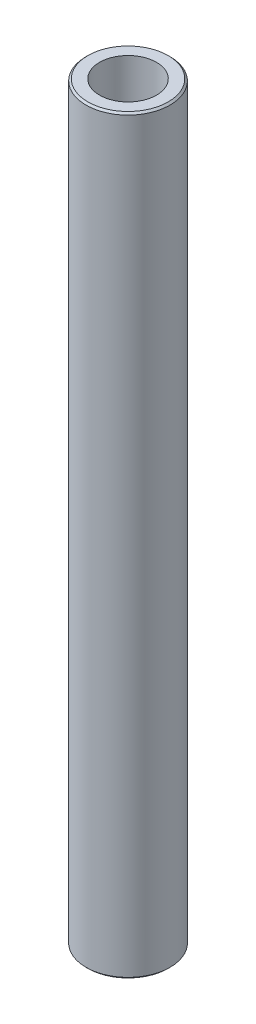
from build123d import *

# Parameters (mm, degrees)
SKETCH1_R           = 12.5
BOSS_EXTRUDE1_DEPTH = 223.375860077
SKETCH2_R           = 8.478781611
CUT_EXTRUDE1_DEPTH  = 225.074261943
CHAMFER1_SIZE       = 0.546231855


with BuildPart() as part:
    # Sketch1 → Boss-Extrude1 (new body)
    with BuildSketch(Plane(origin=(0, 0, 0), x_dir=(1, 0, 0), z_dir=(0, 1, 0))):
        Circle(SKETCH1_R)
    extrude(amount=BOSS_EXTRUDE1_DEPTH)

    # Sketch2 → Cut-Extrude1 (cut, through all)
    with BuildSketch(Plane(origin=(0, 0, 0), x_dir=(1, 0, 0), z_dir=(0, 1, 0))):
        Circle(SKETCH2_R)
    extrude(amount=CUT_EXTRUDE1_DEPTH, mode=Mode.SUBTRACT)

    # Chamfer1
    chamfer1_edges = [part.edges().sort_by_distance(p)[0] for p in [
        (-12.5, 223.375860077, 0),
        (-12.5, 0, 0),
    ]]
    chamfer(chamfer1_edges, length=CHAMFER1_SIZE)


solid = part.part
